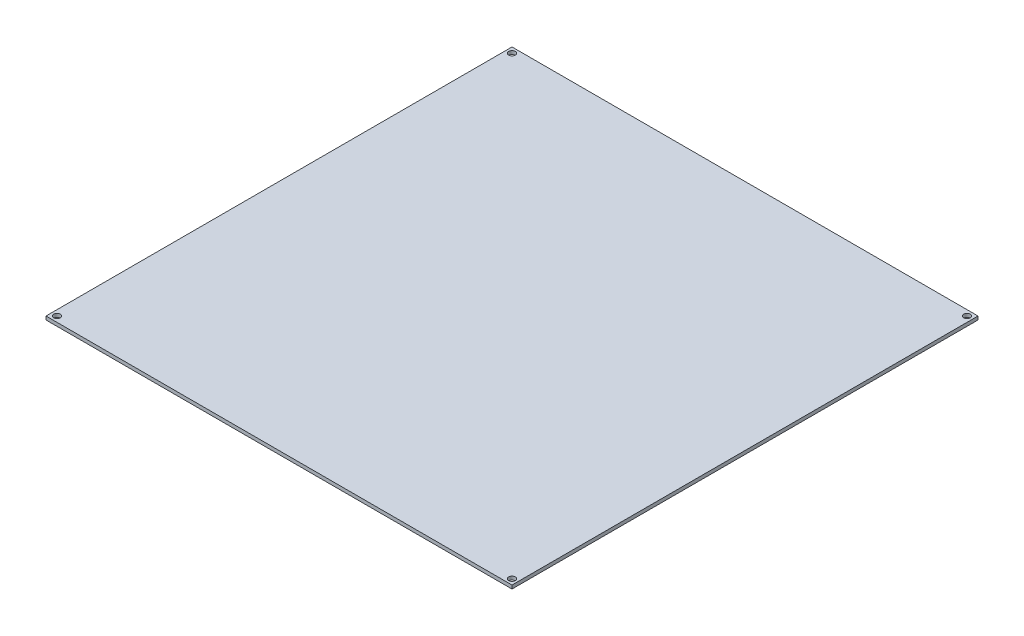
from build123d import *

# Parameters (mm, degrees)
SKETCH1_W           = 214
SKETCH1_H           = 214
SKETCH1_R           = 1.5
BOSS_EXTRUDE1_DEPTH = 0.8


with BuildPart() as part:
    # Sketch1 → Boss-Extrude1 (new, symmetric)
    with BuildSketch(Plane(origin=(0, 0, 0), x_dir=(1, 0, 0), z_dir=(0, 1, 0))):
        Rectangle(SKETCH1_W, SKETCH1_H)
        with Locations((-104.5, 104.5)):
            Circle(SKETCH1_R, mode=Mode.SUBTRACT)
        with Locations((104.5, 104.5)):
            Circle(SKETCH1_R, mode=Mode.SUBTRACT)
        with Locations((-104.5, -104.5)):
            Circle(SKETCH1_R, mode=Mode.SUBTRACT)
        with Locations((104.5, -104.5)):
            Circle(SKETCH1_R, mode=Mode.SUBTRACT)
    extrude(amount=BOSS_EXTRUDE1_DEPTH, both=True)


solid = part.part
